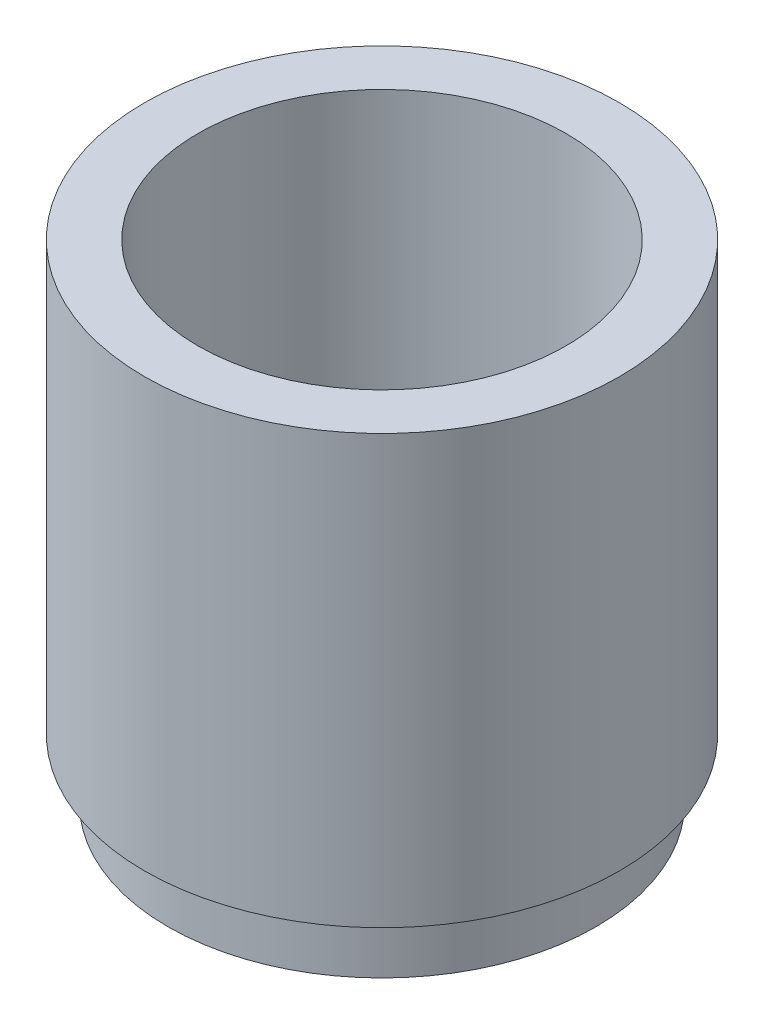
from build123d import *

# Parameters (mm, degrees)
SKETCH1_R           = 8.025
SKETCH1_R_2         = 6.4
BOSS_EXTRUDE1_DEPTH = 2.25
SKETCH2_R           = 8.9
SKETCH2_R_2         = 6.9
BOSS_EXTRUDE2_DEPTH = 16.05


with BuildPart() as part:
    # Sketch1 → Boss-Extrude1 (new body)
    with BuildSketch(Plane(origin=(0, 0, 0), x_dir=(1, 0, 0), z_dir=(0, 1, 0))):
        Circle(SKETCH1_R)
        Circle(SKETCH1_R_2, mode=Mode.SUBTRACT)
    extrude(amount=BOSS_EXTRUDE1_DEPTH)

    # Sketch2 → Boss-Extrude2 (add)
    with BuildSketch(Plane(origin=(0, 2.25, 0), x_dir=(1, 0, 0), z_dir=(0, 1, 0))):
        Circle(SKETCH2_R)
        Circle(SKETCH2_R_2, mode=Mode.SUBTRACT)
    extrude(amount=BOSS_EXTRUDE2_DEPTH)


solid = part.part
